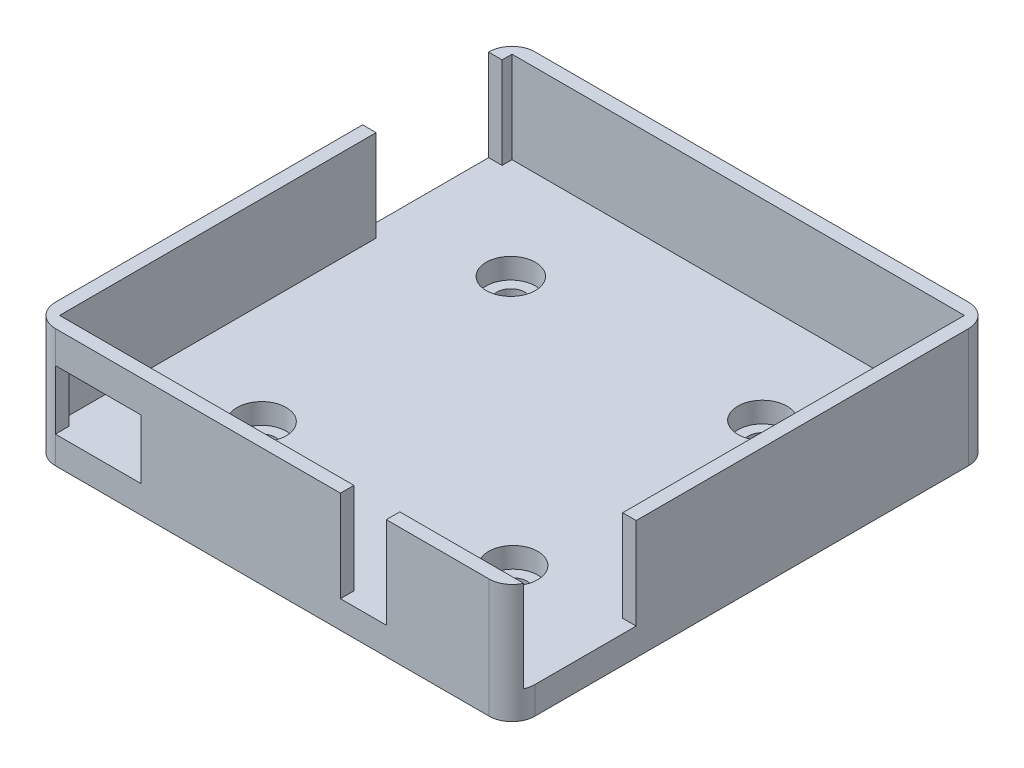
from build123d import *

# Parameters (mm, degrees)
SKETCH1_W           = 50.292
SKETCH1_H           = 50.292
BOSS_EXTRUDE1_DEPTH = 1.27
SKETCH1_3_W         = 53.292
SKETCH1_3_H         = 53.292
SKETCH1_3_W_2       = 50.292
SKETCH1_3_H_2       = 50.292
BOSS_EXTRUDE2_DEPTH = 11.43
SKETCH2_W           = 13.99999994
SKETCH2_H           = 10.16
CUT_EXTRUDE3_DEPTH  = 10
SKETCH3_W           = 9.5
SKETCH3_H           = 6.6
SKETCH3_W_2         = 5.1
SKETCH3_H_2         = 10.16
CUT_EXTRUDE4_DEPTH  = 10
SKETCH4_W           = 12.3
SKETCH4_H           = 10.16
CUT_EXTRUDE5_DEPTH  = 10
FILLET1_R           = 2.54
FILLET2_R           = 2.54
FILLET3_START       = -1
FILLET3_DEPTH       = 13
FILLET4_R           = 2.54
BOSS_EXTRUDE4_DEPTH = 3.048
HOLE1_D             = 3.0988
HOLE1_CBORE_D       = 5.461
HOLE1_CBORE_DEPTH   = 2.286


with BuildPart() as part:
    # Sketch1 → Boss-Extrude1 (new body)
    with BuildSketch(Plane(origin=(0, 0, 0), x_dir=(1, 0, 0), z_dir=(0, 1, 0))):
        Rectangle(SKETCH1_W, SKETCH1_H)
    extrude(amount=BOSS_EXTRUDE1_DEPTH)

    # Sketch1<3> → Boss-Extrude2 (add)
    with BuildSketch(Plane(origin=(0, 0, 0), x_dir=(1, 0, 0), z_dir=(0, 1, 0))):
        Rectangle(SKETCH1_3_W, SKETCH1_3_H)
        Rectangle(SKETCH1_3_W_2, SKETCH1_3_H_2, mode=Mode.SUBTRACT)
    extrude(amount=BOSS_EXTRUDE2_DEPTH)

    # Sketch2 → Cut-Extrude3 (cut)
    with BuildSketch(Plane.ZY.offset(26.646)):
        with Locations((-17.04600003, 6.35)):
            Rectangle(SKETCH2_W, SKETCH2_H)
    extrude(amount=-CUT_EXTRUDE3_DEPTH, mode=Mode.SUBTRACT)

    # Sketch3 → Cut-Extrude4 (cut)
    with BuildSketch(Plane.XY.offset(26.646)):
        with Locations((-19.356, 4.57)):
            Rectangle(SKETCH3_W, SKETCH3_H)
        with Locations((10.126, 6.35)):
            Rectangle(SKETCH3_W_2, SKETCH3_H_2)
    extrude(amount=-CUT_EXTRUDE4_DEPTH, mode=Mode.SUBTRACT)

    # Sketch4 → Cut-Extrude5 (cut)
    with BuildSketch(Plane(origin=(26.646, 0, 0), x_dir=(0, 0, -1), z_dir=(1, 0, 0))):
        with Locations((-18.996, 6.35)):
            Rectangle(SKETCH4_W, SKETCH4_H)
    extrude(amount=-CUT_EXTRUDE5_DEPTH, mode=Mode.SUBTRACT)

    # Fillet1
    fillet1_edges = [part.edges().sort_by_distance(p)[0] for p in [
        (26.646, 5.715, -26.646),
    ]]
    fillet(fillet1_edges, radius=FILLET1_R)

    # Fillet2
    fillet2_edges = [part.edges().sort_by_distance(p)[0] for p in [
        (-26.646, 5.715, -26.646),
    ]]
    fillet(fillet2_edges, radius=FILLET2_R)

    # Fillet3: read off the stored shape, not the designer's step
    # Fillet3 outline → Fillet3 (cut)
    with BuildSketch(Plane(origin=(0, 0, 0), x_dir=(1, 0, 0), z_dir=(0, 1, 0)).offset(FILLET3_START)):
        with BuildLine():
            Line((-26.646, -26.646), (-24.106, -26.646))
            ThreePointArc((-24.106, -26.646), (-25.902051224, -25.902051224), (-26.646, -24.106))
            Line((-26.646, -24.106), (-26.646, -26.646))
        make_face()
    extrude(amount=FILLET3_DEPTH, mode=Mode.SUBTRACT)

    # Fillet4
    fillet4_edges = [part.edges().sort_by_distance(p)[0] for p in [
        (26.646, 5.715, 26.646),
    ]]
    fillet(fillet4_edges, radius=FILLET4_R)

    # Sketch6 → Boss-Extrude4 (add)
    with BuildSketch(Plane(origin=(0, 1.27, 0), x_dir=(1, 0, 0), z_dir=(0, 1, 0))):
        with BuildLine():
            Line((26.646, -24.106), (26.646, 24.106))
            ThreePointArc((26.646, 24.106), (25.902051224, 25.902051224), (24.106, 26.646))
            Line((24.106, 26.646), (-24.106, 26.646))
            ThreePointArc((-24.106, 26.646), (-25.902051224, 25.902051224), (-26.646, 24.106))
            Line((-26.646, 24.106), (-26.646, -24.106))
            ThreePointArc((-26.646, -24.106), (-25.902051224, -25.902051224), (-24.106, -26.646))
            Line((-24.106, -26.646), (24.106, -26.646))
            ThreePointArc((24.106, -26.646), (25.902051224, -25.902051224), (26.646, -24.106))
        make_face()
    extrude(amount=-BOSS_EXTRUDE4_DEPTH)

    # Hole1 (through all)
    with Locations(Plane(origin=(-13.848520203, 1.27, 13.982017818), x_dir=(0, 0, 1), z_dir=(0, 1, 0))):
        with Locations((0, 0), (-27.830538021, -0.133497615), (-27.964035636, 27.697040406), (-0.133497615, 27.830538021)):
            CounterBoreHole(HOLE1_D / 2, HOLE1_CBORE_D / 2, HOLE1_CBORE_DEPTH)


solid = part.part
